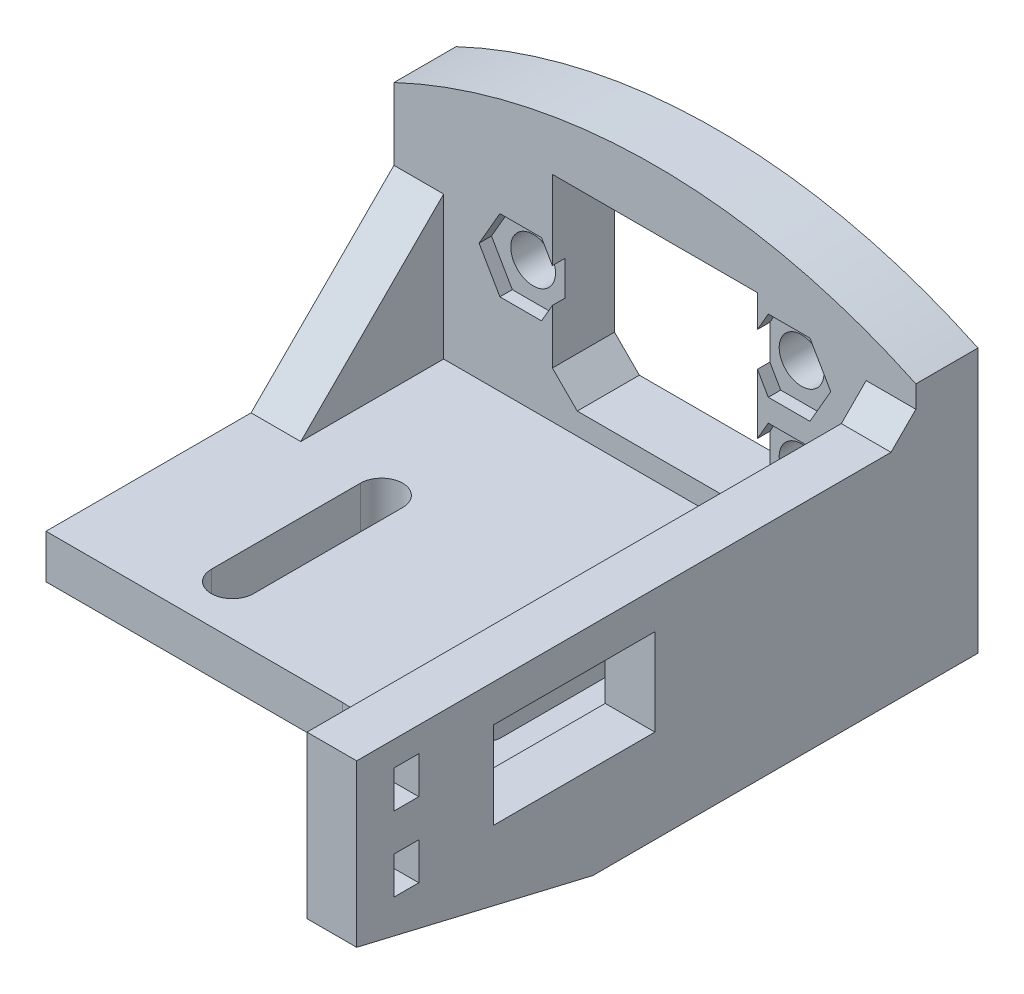
from build123d import *

# Parameters (mm, degrees)
EXTRUDE_START               = -443
EXTRUDE_1_DEPTH             = 10
EXTRUDE_START_2             = -345
EXTRUDE_1_2_OUTLINE_W       = 17
EXTRUDE_1_2_OUTLINE_H       = 4.342105263
EXTRUDE_1_2_DEPTH           = 8.417172155
EXTRUDE_2_DEPTH             = 28
EXTRUDE_3_DEPTH             = 1.157894737
EXTRUDE_4_DEPTH             = 4
SKETCH_5_W                  = 4
SKETCH_5_H                  = 45
EXTRUDE_5_DEPTH             = 13
EXTRUDE_6_DEPTH             = 5
THICKEN_START               = -471
THICKEN_1_DEPTH             = 4
SKETCH_7_W                  = 13
SKETCH_7_H                  = 7
CUT_EXTRUDE_1_DEPTH         = 65.235893393
SKETCH_8_W                  = 2
SKETCH_8_H                  = 3
CUT_EXTRUDE_2_DEPTH         = 65.235893393
SKETCH_9_W                  = 2
SKETCH_9_H                  = 3
CUT_EXTRUDE_3_DEPTH         = 65.235893393
CUT_EXTRUDE_4_DEPTH         = 475.157146946
CUT_EXTRUDE_5_DEPTH         = 475.157146946
SKETCH_12_W                 = 16.5
SKETCH_12_H                 = 15.5
CUT_EXTRUDE_6_DEPTH         = 474.337353269
CUT_EXTRUDE_7_DEPTH         = 1
CUT_EXTRUDE_8_DEPTH         = 1
CUT_EXTRUDE_9_DEPTH         = 1
HOLE_WIZARD_3_6_3_6_1_D     = 3.6
HOLE_WIZARD_3_6_3_6_1_DEPTH = 50
CHAMFER_1_SIZE              = 2
FILLET_1_R                  = 10


with BuildPart() as part:
    # 凸台-拉伸1: read off the stored shape, not the designer's step
    # 凸台-拉伸1 outline → 凸台-拉伸1 (new body)
    with BuildSketch(Plane.YZ.offset(EXTRUDE_START)):
        Polygon((-10.657894737, 43), (-13.5, 31), (-13.5, 5), (-10.657894737, 5), align=None)
    extrude(amount=EXTRUDE_1_DEPTH)

    # Extrude 1 2 outline → Extrude 1 2 (cut)
    with BuildSketch(Plane(origin=(0, 0, 0), x_dir=(0.707106781186548, 0, 0.707106781186547), z_dir=(0.707106781186547, 0, -0.707106781186548)).offset(EXTRUDE_START_2)):
        with Locations((-282.5, 12.828947369)):
            Rectangle(EXTRUDE_1_2_OUTLINE_W, EXTRUDE_1_2_OUTLINE_H)
    extrude(amount=EXTRUDE_1_2_DEPTH, mode=Mode.SUBTRACT)

    # 草图2 → 凸台-拉伸2 (add)
    with BuildSketch(Plane.ZY.offset(443)):
        Polygon((5, -10.657894737), (33, -10.657894737), (33, -13.026315789), (31, -13.5), (5, -13.5), align=None)
    extrude(amount=EXTRUDE_2_DEPTH)

    # 草图3 → 凸台-拉伸3 (add)
    with BuildSketch(Plane(origin=(0, -10.657894737, 0), x_dir=(-1, 0, 0), z_dir=(0, 1, 0))):
        Polygon((471, 5), (433, 5), (433, 43), (443, 33), (471, 33), align=None)
    extrude(amount=EXTRUDE_3_DEPTH)

    # 草图4 → 凸台-拉伸4 (add)
    with BuildSketch(Plane(origin=(-433, 0, 0), x_dir=(0, 0, -1), z_dir=(1, 0, 0))):
        Polygon((-50, -9), (-5, -9), (-5, -13.5), (-31, -13.5), align=None)
    extrude(amount=EXTRUDE_4_DEPTH)

    # 草图5 → 凸台-拉伸5 (add)
    with BuildSketch(Plane(origin=(0, -9, 0), x_dir=(-1, 0, 0), z_dir=(0, 1, 0))):
        with Locations((431, 27.5)):
            Rectangle(SKETCH_5_W, SKETCH_5_H)
    extrude(amount=EXTRUDE_5_DEPTH)

    # 草图6 → 凸台-拉伸6 (add)
    with BuildSketch(Plane(origin=(0, 0, 5), x_dir=(-1, 0, 0), z_dir=(0, 0, -1))):
        with BuildLine():
            Line((429, -13.5), (429, 7.771887242))
            ThreePointArc((429, 7.771887242), (450, 12.5), (471, 7.771887242))
            Line((471, 7.771887242), (471, -13.5))
            Line((471, -13.5), (429, -13.5))
        make_face()
    extrude(amount=EXTRUDE_6_DEPTH)

    # 加厚1: read off the stored shape, not the designer's step
    # 加厚1 outline → 加厚1 (add)
    with BuildSketch(Plane.YZ.offset(THICKEN_START)):
        Polygon((2, 5), (-9.5, 16.5), (-9.5, 5), align=None)
    extrude(amount=THICKEN_1_DEPTH)

    # 草图7 → 切除-拉伸1 (cut, through all)
    with BuildSketch(Plane.ZY.offset(433)):
        with Locations((32.5, -2.5)):
            Rectangle(SKETCH_7_W, SKETCH_7_H)
    extrude(amount=-CUT_EXTRUDE_1_DEPTH, mode=Mode.SUBTRACT)

    # 草图8 → 切除-拉伸2 (cut, through all)
    with BuildSketch(Plane.ZY.offset(433)):
        with Locations((46, 0.5)):
            Rectangle(SKETCH_8_W, SKETCH_8_H)
    extrude(amount=-CUT_EXTRUDE_2_DEPTH, mode=Mode.SUBTRACT)

    # 草图9 → 切除-拉伸3 (cut, through all)
    with BuildSketch(Plane.ZY.offset(433)):
        with Locations((46, -5.5)):
            Rectangle(SKETCH_9_W, SKETCH_9_H)
    extrude(amount=-CUT_EXTRUDE_3_DEPTH, mode=Mode.SUBTRACT)

    # 草图10 → 切除-拉伸4 (cut, through all)
    with BuildSketch(Plane(origin=(0, -9.5, 0), x_dir=(-1, 0, 0), z_dir=(0, 1, 0))):
        with BuildLine():
            Line((438.3, 29.000393674), (438.3, 10.000393674))
            ThreePointArc((438.3, 10.000393674), (440, 8.300393674), (441.7, 10.000393674))
            Line((441.7, 10.000393674), (441.7, 29.000393674))
            ThreePointArc((441.7, 29.000393674), (440, 30.700393674), (438.3, 29.000393674))
        make_face()
    extrude(amount=-CUT_EXTRUDE_4_DEPTH, mode=Mode.SUBTRACT)

    # 草图11 → 切除-拉伸5 (cut, through all)
    with BuildSketch(Plane(origin=(0, -9.5, 0), x_dir=(-1, 0, 0), z_dir=(0, 1, 0))):
        with BuildLine():
            Line((458.3, 29.000393674), (458.3, 17.000393674))
            ThreePointArc((458.3, 17.000393674), (460, 15.300393674), (461.7, 17.000393674))
            Line((461.7, 17.000393674), (461.7, 29.000393674))
            ThreePointArc((461.7, 29.000393674), (460, 30.700393674), (458.3, 29.000393674))
        make_face()
    extrude(amount=-CUT_EXTRUDE_5_DEPTH, mode=Mode.SUBTRACT)

    # 草图12 → 切除-拉伸6 (cut, through all)
    with BuildSketch(Plane.XY.offset(5)):
        with Locations((-450, 0)):
            Rectangle(SKETCH_12_W, SKETCH_12_H)
    extrude(amount=-CUT_EXTRUDE_6_DEPTH, mode=Mode.SUBTRACT)

    # 草图13 → 切除-拉伸7 (cut)
    with BuildSketch(Plane.XY.offset(5)):
        Polygon((-458.25, 1.385640646), (-459.125, 2.901185103), (-462.475, 2.901185103), (-464.15, 0), (-462.475, -2.901185103), (-459.125, -2.901185103), (-458.25, -1.385640646), align=None)
    extrude(amount=-CUT_EXTRUDE_7_DEPTH, mode=Mode.SUBTRACT)

    # 草图14 → 切除-拉伸8 (cut)
    with BuildSketch(Plane.XY.offset(5)):
        Polygon((-441.75, 2.414359354), (-440.875, 0.898814897), (-437.525, 0.898814897), (-435.85, 3.8), (-437.525, 6.701185103), (-440.875, 6.701185103), (-441.75, 5.185640646), align=None)
    extrude(amount=-CUT_EXTRUDE_8_DEPTH, mode=Mode.SUBTRACT)

    # 草图15 → 切除-拉伸9 (cut)
    with BuildSketch(Plane.XY.offset(5)):
        Polygon((-441.75, -5.185640646), (-440.875, -6.701185103), (-437.525, -6.701185103), (-435.85, -3.8), (-437.525, -0.898814897), (-440.875, -0.898814897), (-441.75, -2.414359354), align=None)
    extrude(amount=-CUT_EXTRUDE_9_DEPTH, mode=Mode.SUBTRACT)

    # Ø3.6 (3.6) 直径孔1
    with Locations(Plane(origin=(0, 0, 0), x_dir=(-1, 0, 0), z_dir=(0, 0, -1))):
        with Locations((439.2, -3.8), (439.2, 3.8), (460.8, 0)):
            Hole(HOLE_WIZARD_3_6_3_6_1_D / 2, depth=HOLE_WIZARD_3_6_3_6_1_DEPTH)

    # 倒角1
    chamfer_1_edges = [part.edges().sort_by_distance(p)[0] for p in [
        (-431, 4, 5),
        (-441.75, -7.75, 2.5),
        (-458.25, -7.75, 2.5),
    ]]
    chamfer(chamfer_1_edges, length=CHAMFER_1_SIZE)

    # 圆角1
    fillet_1_edges = [part.edges().sort_by_distance(p)[0] for p in [
        (-443, -11.842105263, 33),
        (-433, -10.078947368, 43),
    ]]
    fillet(fillet_1_edges, radius=FILLET_1_R)


solid = part.part
